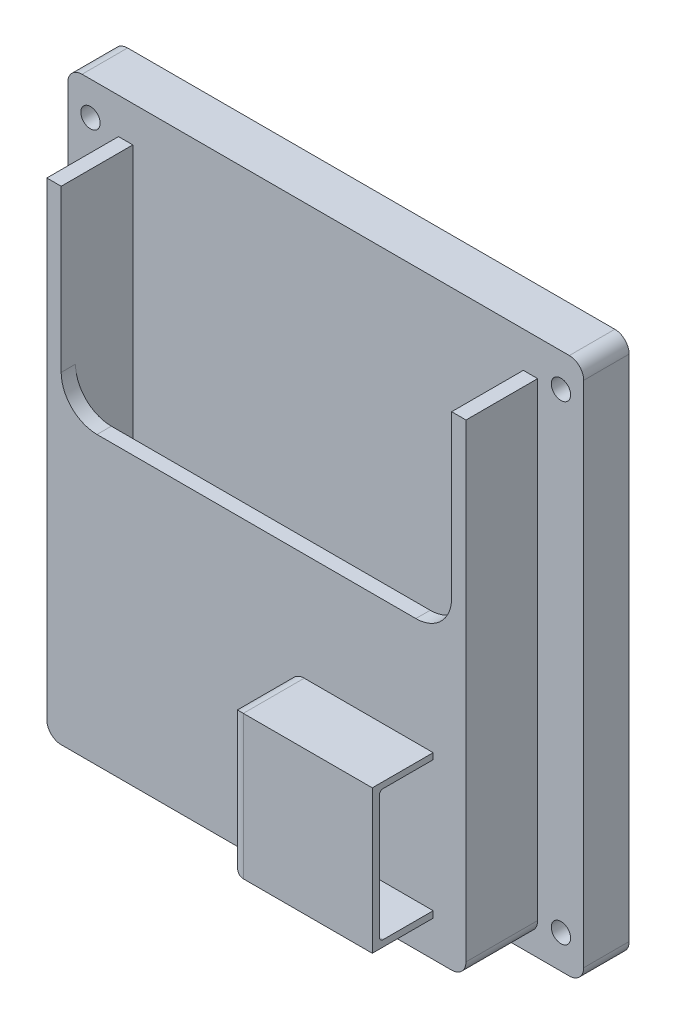
from build123d import *

# Parameters (mm, degrees)
SKETCH1_W           = 72
SKETCH1_H           = 75
SKETCH1_R           = 1.35
BOSS_EXTRUDE1_DEPTH = 6.35
BOSS_EXTRUDE2_DEPTH = 10
SKETCH3_W           = 58.5
SKETCH3_H           = 40
BOSS_EXTRUDE3_DEPTH = 2
FILLET1_R           = 5
SKETCH4_W           = 20
SKETCH4_H           = 20
BOSS_EXTRUDE4_DEPTH = 8.5
SKETCH5_W           = 7.5
SKETCH5_H           = 18.25
CUT_EXTRUDE1_DEPTH  = 18.5
FILLET2_R           = 0.5
FILLET3_R           = 2
FILLET4_R           = 2


with BuildPart() as part:
    # Sketch1 → Boss-Extrude1 (new body)
    with BuildSketch(Plane.XY):
        Rectangle(SKETCH1_W, SKETCH1_H)
        with Locations((-32.83, 32.83)):
            Circle(SKETCH1_R, mode=Mode.SUBTRACT)
        with Locations((-32.83, -32.83)):
            Circle(SKETCH1_R, mode=Mode.SUBTRACT)
        with Locations((32.83, 32.83)):
            Circle(SKETCH1_R, mode=Mode.SUBTRACT)
        with Locations((32.83, -32.83)):
            Circle(SKETCH1_R, mode=Mode.SUBTRACT)
    extrude(amount=BOSS_EXTRUDE1_DEPTH)

    # Sketch2 → Boss-Extrude2 (add)
    with BuildSketch(Plane.XY.offset(6.35)):
        Polygon((-26.92, 32.5), (-28.92, 32.5), (-28.92, -35), (29.58, -35), (29.58, 32.5), (27.58, 32.5), (27.58, -32.5), (-26.92, -32.5), align=None)
    extrude(amount=BOSS_EXTRUDE2_DEPTH)

    # Sketch3 → Boss-Extrude3 (add)
    with BuildSketch(Plane.XY.offset(16.35)):
        with Locations((0.33, -15)):
            Rectangle(SKETCH3_W, SKETCH3_H)
    extrude(amount=-BOSS_EXTRUDE3_DEPTH)

    # Fillet1
    fillet1_edges = [part.edges().sort_by_distance(p)[0] for p in [
        (-26.92, 5, 15.35),
        (27.58, 5, 15.35),
    ]]
    fillet(fillet1_edges, radius=FILLET1_R)

    # Sketch4 → Boss-Extrude4 (add)
    with BuildSketch(Plane.XY.offset(16.35)):
        with Locations((15, -20)):
            Rectangle(SKETCH4_W, SKETCH4_H)
    extrude(amount=BOSS_EXTRUDE4_DEPTH)

    # Sketch5 → Cut-Extrude1 (cut)
    with BuildSketch(Plane(origin=(25, 0, 0), x_dir=(0, 0, -1), z_dir=(1, 0, 0))):
        with Locations((-20.1, -19.975)):
            Rectangle(SKETCH5_W, SKETCH5_H)
    extrude(amount=-CUT_EXTRUDE1_DEPTH, mode=Mode.SUBTRACT)

    # Fillet2
    fillet2_edges = [part.edges().sort_by_distance(p)[0] for p in [
        (15.75, -29.1, 23.85),
        (15.75, -10.85, 23.85),
    ]]
    fillet(fillet2_edges, radius=FILLET2_R)

    # Fillet3
    fillet3_edges = [part.edges().sort_by_distance(p)[0] for p in [
        (-36, 37.5, 3.175),
        (36, 37.5, 3.175),
        (29.58, -35, 11.35),
        (36, -37.5, 3.175),
        (-36, -37.5, 3.175),
        (-28.92, -35, 11.35),
    ]]
    fillet(fillet3_edges, radius=FILLET3_R)

    # Fillet4
    fillet4_edges = [part.edges().sort_by_distance(p)[0] for p in [
        (5, -20, 24.85),
        (5, -10, 20.6),
        (5, -30, 20.6),
    ]]
    fillet(fillet4_edges, radius=FILLET4_R)


solid = part.part
